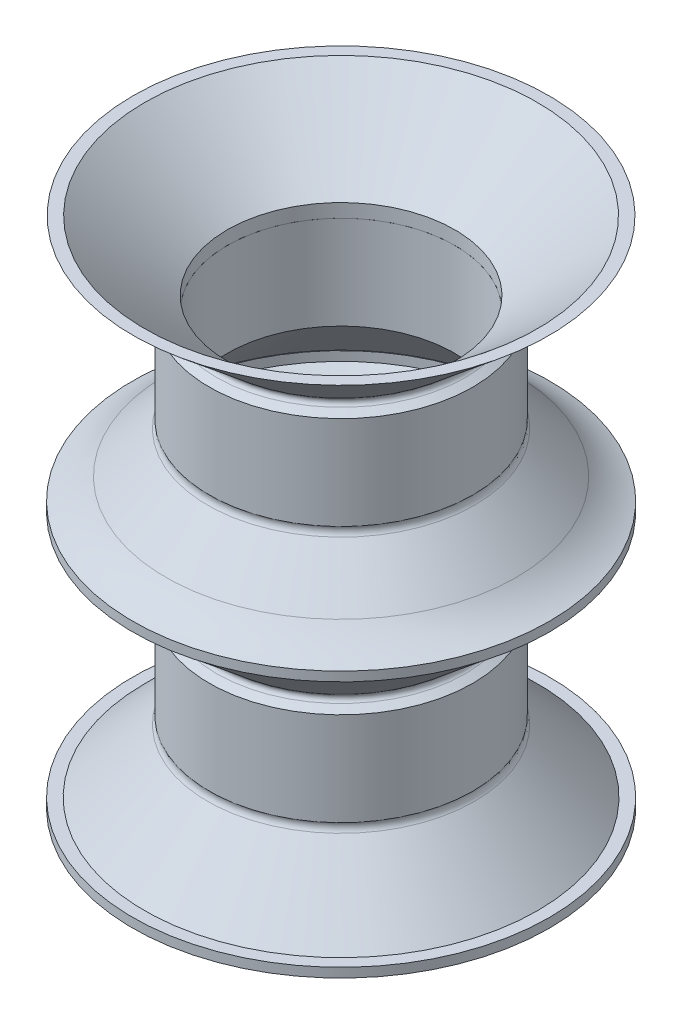
from build123d import *

# Parameters (mm, degrees)
ACTIVE_FILLET_R     = 0.5
SKETCH11_R          = 14.103676921920666
SKETCH11_R_2        = 12.180725781348816
COLLAR_DEPTH        = 10
PASSIVE_FILLET_R    = 0.8
SKETCH15_R          = 22.29457906148835
SKETCH15_R_2        = 19.722102711916126
BOSS_EXTRUDE2_DEPTH = 1
CIRPATTERN1_COUNT   = 4
FILLET1_R           = 10


with BuildPart() as part:
    # Sketch1 → Main Active (revolve)
    with BuildSketch(Plane.XY):
        Polygon((-0.44430417046757187, 0), (-9.97833291122136, 8), (-8.733753849733018, 8), (0.08552036891816808, 0.5997502558785777), (0.08552036891816808, -0.8481847341285212), (-1.8374307716536824, -0.8481847341285211), align=None)
    revolve(axis=Axis((12.266246150266982, 7.609018032819944, 0), (1.1e-16, -1, 0)))

    # Active fillet
    active_fillet_edges = [part.edges().sort_by_distance(p)[0] for p in [
        (24.976796471001535, 3.23e-15, -1.56e-15),
    ]]
    fillet(active_fillet_edges, radius=ACTIVE_FILLET_R)

    # Cut-Sweep2: sweep along a path in Sketch19
    with BuildLine(Plane(origin=(-0.18357578046802644, -0.2187770958860591, 2e-17), x_dir=(-0.7660444431189819, 0.6427876096865347, 0), z_dir=(-0.6427876096865347, -0.7660444431189819, 0))) as cut_sweep2_path:
        Line((11.230423528864234, 1.22e-15), (6.789896246932316, 1.18e-15))
    # Sketch18 → Cut-Sweep2 (sweep, cut)
    with BuildSketch(Plane(origin=(-8e-16, 7.000000000000001, 0), x_dir=(1, 1.1e-16, 0), z_dir=(-1.1e-16, 1, 0))):
        Polygon((-8.62308060460278, -0.35), (-9.07308060460278, -0.34999999999999987), (-9.07308060460278, 0.34999999999999987), (-8.62308060460278, 0.35), align=None)
    cut_sweep2 = sweep(path=cut_sweep2_path.line, mode=Mode.SUBTRACT)

    # CirPattern1: Cut-Sweep2 ×4 about axis
    cirpattern1_axis = Axis((12.266246150266984, 0, -2.694e-14), (0, 1, 0))
    for i in range(1, CIRPATTERN1_COUNT):
        add(cut_sweep2.rotate(cirpattern1_axis, i * 360 / CIRPATTERN1_COUNT), mode=Mode.SUBTRACT)


with BuildPart() as body_2:
    # Sketch11 → collar (new body)
    with BuildSketch(Plane.XZ.offset(0.848184734128521)):
        with Locations((12.266246150266984, 0)):
            Circle(SKETCH11_R)
        with Locations((12.266246150266984, 0)):
            Circle(SKETCH11_R_2, mode=Mode.SUBTRACT)
    extrude(amount=COLLAR_DEPTH)

    # Sketch14 → Passive Element (revolve)
    with BuildSketch(Plane.XY, mode=Mode.PRIVATE) as passive_element_sk:
        Polygon((-1.1589875659701498, -10.848184734128521), (-8.766364496537454, -18.455561664695857), (-7.521856561649136, -18.45556166469586), (0.08552036891816897, -10.848184734128521), align=None)
    revolve(passive_element_sk.sketch.rotate(Axis((12.266246150266984, -19.969844330252183, 0), (-1.2e-16, 1, 0)), 180), axis=Axis((12.266246150266984, -19.969844330252183, 0), (-1.2e-16, 1, 0)))

    # Passive Fillet
    # the kernel refuses this fillet: 0.8 mm, written as the material it adds along each edge
    with BuildSketch(Plane(origin=(12.266246150266982, -10.84818473412852, 0), x_dir=(1, 1.3e-16, 1.2e-16), z_dir=(-1.2e-16, 0, 1))) as passive_fillet_piece_1:
        with BuildLine():
            CenterArc((14.848517187625331, -0.2919126214897238), PASSIVE_FILLET_R, 158.5991389184753, 66.40086108152457)
            Line((14.282831762676091, -0.8575980464389606), (14.271518054177106, -0.8689117549379458))
            Line((14.271518054177106, -0.8689117549379458), (13.413920007738147, -0.01131370849898516))
            Line((13.413920007738147, -0.01131370849898516), (13.425233716237132, 0.01600000000000001))
            ThreePointArc((13.425233716237132, 0.01600000000000001), (13.764455319078897, 0.01599999999999997), (14.08878011660657, 0.00583825242979499))
            Line((14.08878011660657, 0.00583825242979499), (14.103676921920664, -9e-17))
        make_face()
    revolve(axis=Axis((12.266246150266982, -10.84818473412852, 0), (-1.2e-16, 1, 0)))

    # Sketch15 → Boss-Extrude2 (add)
    with BuildSketch(Plane.XZ.offset(18.455561664695857)):
        with Locations((12.266246150266984, 0)):
            Circle(SKETCH15_R)
        with Locations((12.266246150266984, 0)):
            Circle(SKETCH15_R_2, mode=Mode.SUBTRACT)
    extrude(amount=BOSS_EXTRUDE2_DEPTH)


with BuildPart() as body_3:
    # Body-Move/Copy2: read off the stored shape, not the designer's step
    # Body-Move/Copy2: copy of body 2
    add(body_2.part.moved(Location((0, 27.45, 0))))

    # Fillet1
    # the kernel refuses this fillet: 10 mm, written as the material it adds along each edge
    with BuildSketch(Plane(origin=(12.266246150266984, 8.994438335304146, 0), x_dir=(1, 1.7e-16, 1.2e-16), z_dir=(-1.2e-16, 0, 1))) as fillet1_piece_1:
        with BuildLine():
            CenterArc((25.81484706108966, 9.359899209445736), FILLET1_R, 224.9999999999999, 24.388666535893208)
            Line((18.743779249224175, 2.2888313975802714), (18.602357892986863, 2.147410041342962))
            Line((18.602357892986863, 2.147410041342962), (20.89118929056713, -0.14142135623731097))
            Line((20.89118929056713, -0.14142135623731097), (21.03261064680444, -0.20000000000000107))
            ThreePointArc((21.03261064680444, -0.20000000000000107), (21.663594854146393, -0.20000000000000118), (22.224173701496323, -0.1871979841889184))
            Line((22.224173701496323, -0.1871979841889184), (22.294579061488346, -3.77e-15))
        make_face()
    revolve(axis=Axis((12.266246150266984, 8.994438335304146, 0), (-1.2e-16, 1, 0)))


with BuildPart() as body_4:
    # Body-Move_Copy2 2: copy of part
    add(part.part.moved(Location((0, 27.45, 0))))


solid = Compound([part.part, body_2.part, body_3.part, body_4.part])
